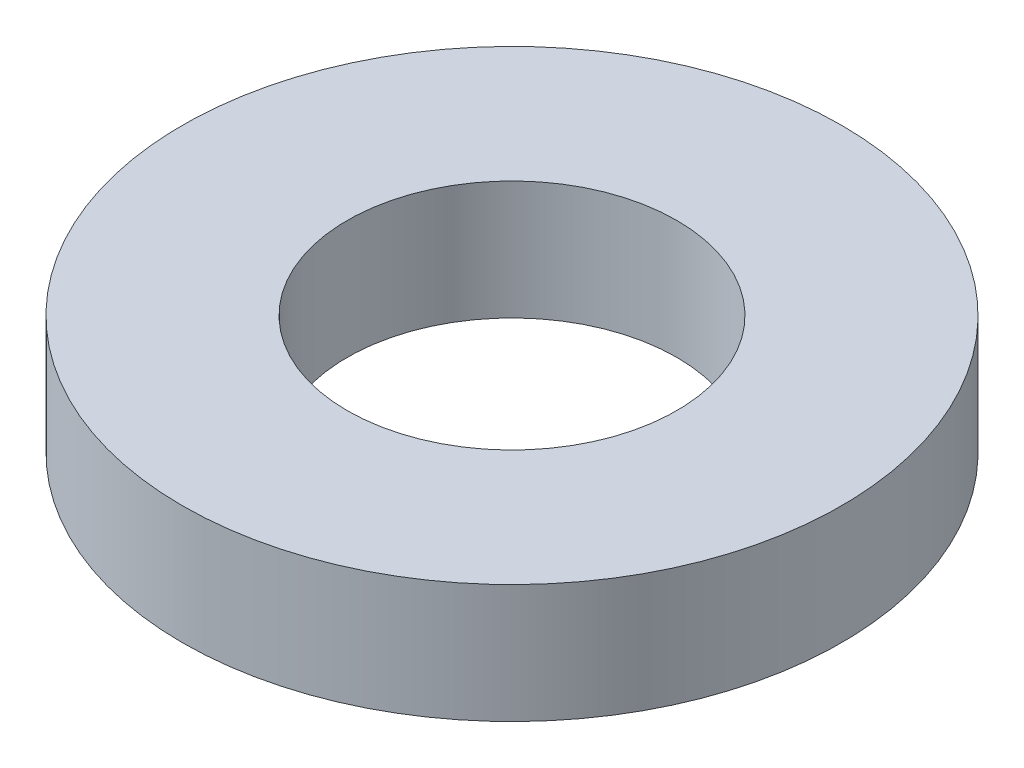
from build123d import *

# Parameters (mm, degrees)
SKETCH1_R           = 75
BOSS_EXTRUDE1_DEPTH = 27
SKETCH2_R           = 37.5
CUT_EXTRUDE1_DEPTH  = 110.448618082


with BuildPart() as part:
    # Sketch1 → Boss-Extrude1 (new body)
    with BuildSketch(Plane(origin=(0, 0, 0), x_dir=(1, 0, 0), z_dir=(0, 1, 0))):
        Circle(SKETCH1_R)
    extrude(amount=BOSS_EXTRUDE1_DEPTH)

    # Sketch2 → Cut-Extrude1 (cut, through all)
    with BuildSketch(Plane(origin=(0, 0, 0), x_dir=(1, 0, 0), z_dir=(0, 1, 0))):
        Circle(SKETCH2_R)
    extrude(amount=CUT_EXTRUDE1_DEPTH, mode=Mode.SUBTRACT)


solid = part.part
